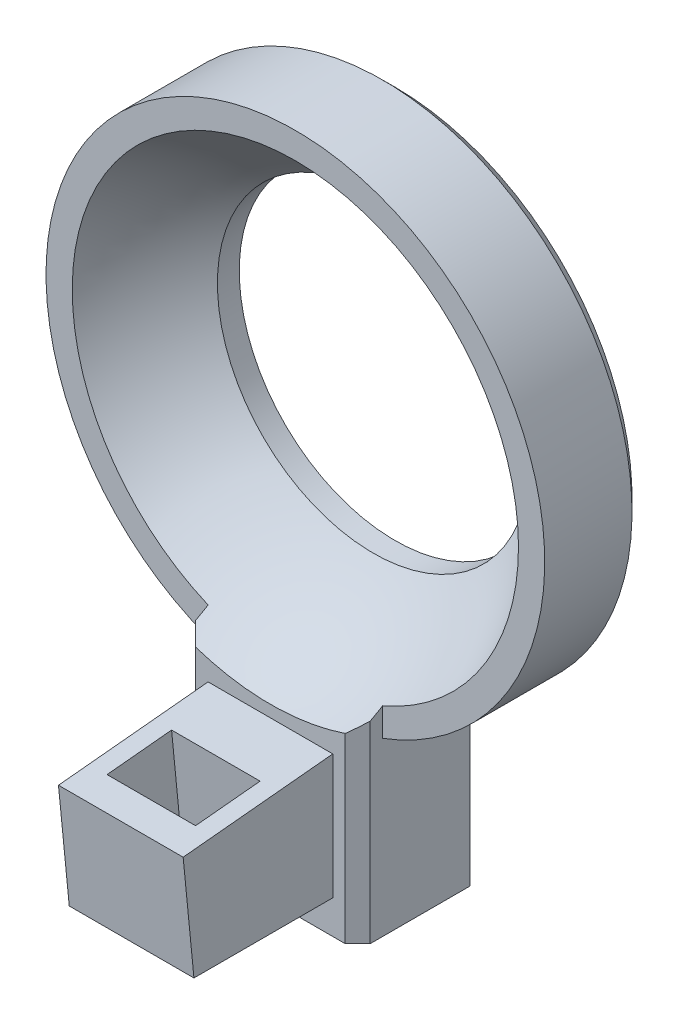
from build123d import *

# Parameters (mm, degrees)
SKETCH1_R           = 20
SKETCH1_R_2         = 12.5
BOSS_EXTRUDE1_DEPTH = 8
BOSS_EXTRUDE2_DEPTH = 10
SKETCH4_W           = 6.3
SKETCH4_H           = 6.3
CUT_EXTRUDE1_DEPTH  = 12
BOSS_EXTRUDE4_DEPTH = 5
SKETCH13_W          = 7.1
SKETCH13_H          = 5.2
CUT_EXTRUDE5_DEPTH  = 50.61829231
CHAMFER1_SIZE       = 1


with BuildPart() as part:
    # Sketch1 → Boss-Extrude1 (new body)
    with BuildSketch(Plane.XY):
        Circle(SKETCH1_R)
        Circle(SKETCH1_R_2, mode=Mode.SUBTRACT)
    extrude(amount=BOSS_EXTRUDE1_DEPTH)

    # Sketch3 → Boss-Extrude2 (add)
    with BuildSketch(Plane.XY):
        Polygon((-7, -18.734993995), (-7, -32.5), (7, -32.5), (7, -18.734993995), (7, -15.234993995), (-7, -15.234993995), align=None)
    extrude(amount=BOSS_EXTRUDE2_DEPTH)

    # Sketch2 → Cut-Revolve2 (revolve, cut)
    with BuildSketch(Plane(origin=(0, 0, 0), x_dir=(1, 0, 0), z_dir=(0, 1, 0))):
        with BuildLine():
            Line((0, -38.5), (0, 2.5))
            ThreePointArc((0, 2.5), (-20.5, -18), (0, -38.5))
        make_face()
    revolve(axis=Axis((0, 0, 8), (0, 0, -1)), mode=Mode.SUBTRACT)

    # Sketch4 → Cut-Extrude1 (cut)
    with BuildSketch(Plane.XZ.offset(32.5)):
        with Locations((0, 5)):
            Rectangle(SKETCH4_W, SKETCH4_H)
    extrude(amount=-CUT_EXTRUDE1_DEPTH, mode=Mode.SUBTRACT)

    # Sketch11 → Boss-Extrude4 (add, symmetric)
    with BuildSketch(Plane(origin=(0, 0, 0), x_dir=(0, 0, -1), z_dir=(1, 0, 0))):
        Polygon((-10, -19.814034065), (-22, -20.990377461), (-21.135029153, -29.814034065), (-10, -29.814034065), align=None)
    extrude(amount=BOSS_EXTRUDE4_DEPTH, both=True)

    # Sketch13 → Cut-Extrude5 (cut, through all)
    with BuildSketch(Plane(origin=(0, -18.654485579, -1.828673409), x_dir=(1, 0, 0), z_dir=(0, 0.9952295494196667, 0.09756097560975642))):
        with Locations((0, -18.884652651)):
            Rectangle(SKETCH13_W, SKETCH13_H)
    extrude(amount=-CUT_EXTRUDE5_DEPTH, mode=Mode.SUBTRACT)

    # Chamfer1
    chamfer1_edges = [part.edges().sort_by_distance(p)[0] for p in [
        (7, -25.617496998, 0),
        (-7, -25.617496998, 0),
        (0, 20, 0),
        (-7, -25.014274071, 10),
        (7, -25.014274071, 10),
    ]]
    chamfer(chamfer1_edges, length=CHAMFER1_SIZE)


solid = part.part
